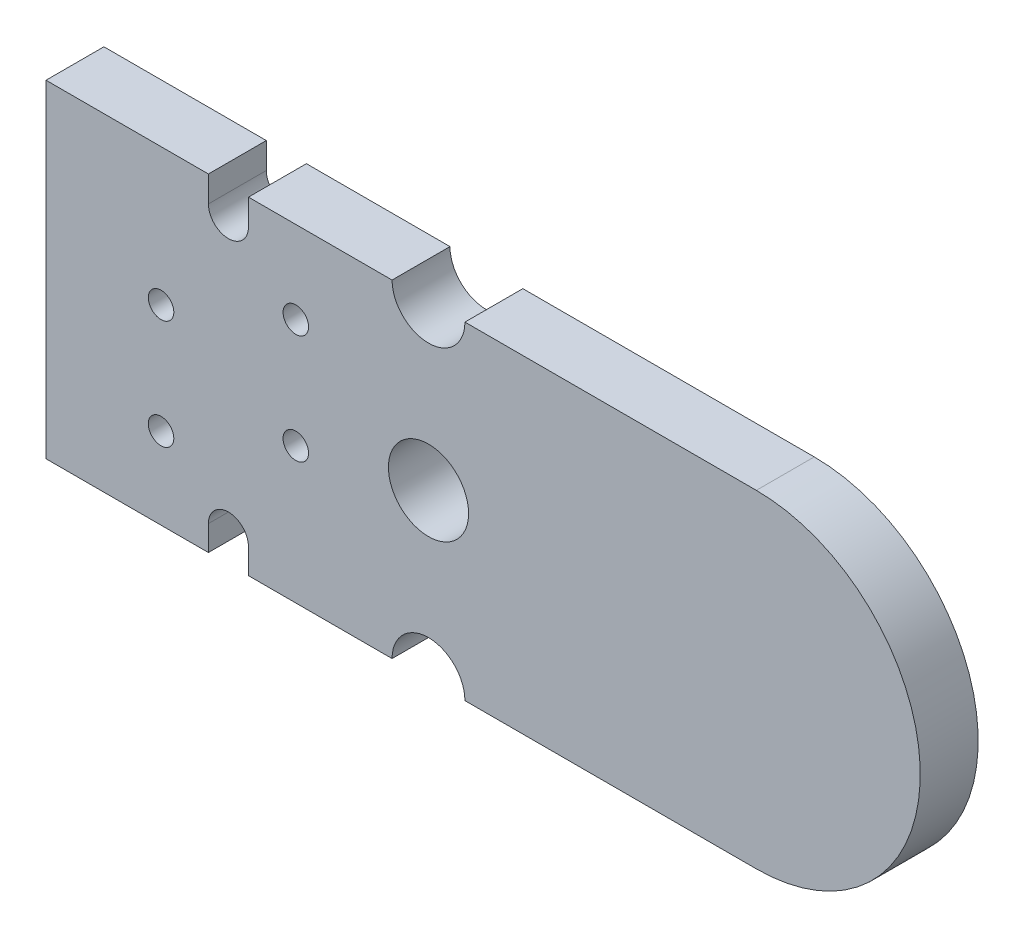
from build123d import *

# Parameters (mm, degrees)
BOARD_DEPTH                        = 1.59
F_1_0_228_DIAMETER_HOLE1_OUTLINE_R = 0.35
F_1_0_228_DIAMETER_HOLE1_DEPTH     = 1.59
SKETCH4_R                          = 1.1
CUT_EXTRUDE1_DEPTH                 = 106.554608126


# Read off the part's stored shape, not the designer's step: #1 (0.228) Diameter Hole1
with BuildPart() as part:
    # Sketch1 → Board (new body)
    with BuildSketch(Plane.XY):
        with BuildLine():
            Line((27.45799, 93.788), (27.45799, 94.5))
            Line((27.45799, 94.5), (22.99997, 94.5))
            Line((22.99997, 94.5), (22.99997, 85.5))
            Line((22.99997, 85.5), (27.45799, 85.49998))
            Line((27.45799, 85.49998), (27.45799, 86.18801))
            ThreePointArc((27.45799, 86.18801), (28.00799, 86.73801), (28.55799, 86.18801))
            Line((28.55799, 86.18801), (28.55799, 85.49998))
            Line((28.55799, 85.49998), (32.49999, 85.49998))
            ThreePointArc((32.49999, 85.49998), (33.49997, 86.49998), (34.49997, 85.5))
            Line((34.49997, 85.5), (42.49997, 85.5))
            ThreePointArc((42.49997, 85.5), (46.999970177, 90), (42.49997, 94.5))
            Line((42.49997, 94.5), (34.49997, 94.5))
            ThreePointArc((34.49997, 94.5), (33.49997, 93.5), (32.49997, 94.5))
            Line((32.49997, 94.5), (28.55799, 94.5))
            Line((28.55799, 94.5), (28.55799, 93.788))
            ThreePointArc((28.55799, 93.788), (28.00799, 93.238), (27.45799, 93.788))
        make_face()
    extrude(amount=BOARD_DEPTH)

    # #1 (0.228) Diameter Hole1 outline → #1 (0.228) Diameter Hole1 (cut)
    with BuildSketch(Plane.XY):
        with Locations((29.85799, 92.238)):
            Circle(F_1_0_228_DIAMETER_HOLE1_OUTLINE_R)
        with Locations((26.15799, 90.738)):
            Circle(F_1_0_228_DIAMETER_HOLE1_OUTLINE_R)
        with Locations((29.85799, 89.238)):
            Circle(F_1_0_228_DIAMETER_HOLE1_OUTLINE_R)
        with Locations((26.15799, 87.738)):
            Circle(F_1_0_228_DIAMETER_HOLE1_OUTLINE_R)
    extrude(amount=F_1_0_228_DIAMETER_HOLE1_DEPTH, mode=Mode.SUBTRACT)

    # Sketch4 → Cut-Extrude1 (cut, through all)
    with BuildSketch(Plane.XY.offset(1.59)):
        with Locations((33.49997, 90)):
            Circle(SKETCH4_R)
    extrude(amount=-CUT_EXTRUDE1_DEPTH, mode=Mode.SUBTRACT)


solid = part.part
